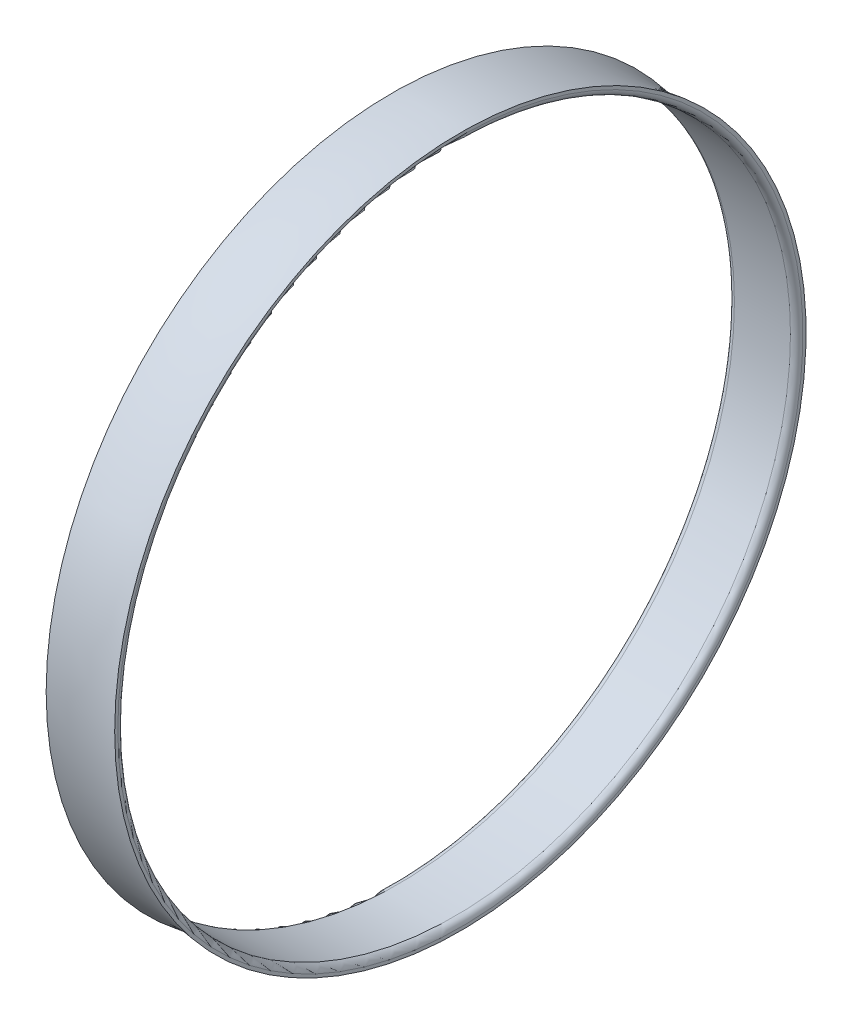
from build123d import *


with BuildPart() as part:
    # Szkic1 → Obrót1 (revolve)
    with BuildSketch(Plane.XY):
        with BuildLine():
            Line((5.785570362, 53.997225536), (14.785570362, 53.997225536))
            ThreePointArc((14.785570362, 53.997225536), (15.492677143, 54.290118755), (15.785570362, 54.997225536))
            Line((15.785570362, 54.997225536), (15.785570362, 55.5))
            ThreePointArc((15.785570362, 55.5), (10.285570362, 54.991524206), (4.785570362, 55.5))
            Line((4.785570362, 55.5), (4.785570362, 54.997225536))
            ThreePointArc((4.785570362, 54.997225536), (5.078463581, 54.290118755), (5.785570362, 53.997225536))
        make_face()
    revolve(axis=Axis((-59.633930429, 0, 0), (1, 0, 0)))


solid = part.part
